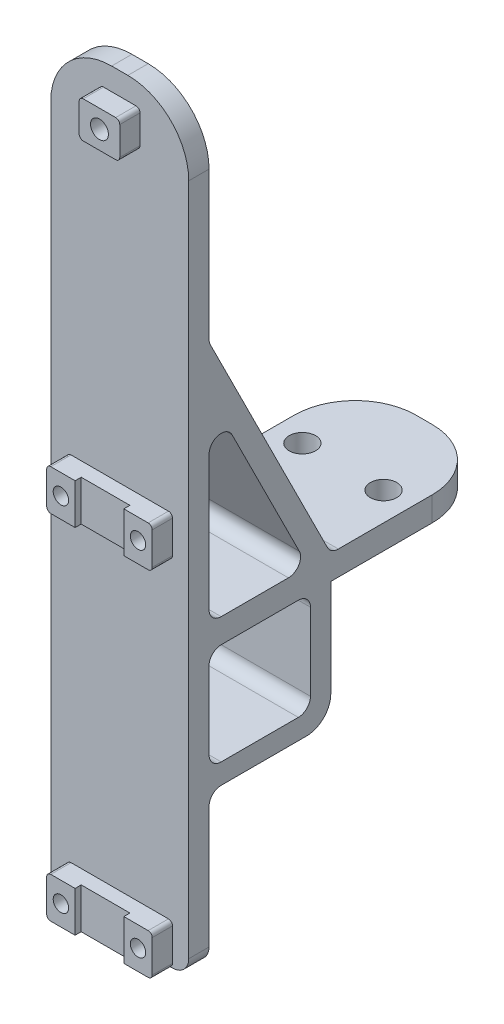
from build123d import *

# Parameters (mm, degrees)
EXTRUDE_1_DEPTH      = 3
EXTRUDE_1_DEPTH_BACK = 3
SKETCH_1_W           = 34
SKETCH_1_H           = 70
SKETCH_3_W           = 34
SKETCH_3_H           = 230
EXTRUDE_2_DEPTH      = 5
SKETCH_4_W           = 34
SKETCH_4_H           = 5
EXTRUDE_3_DEPTH      = 30
EXTRUDE_START        = -5
EXTRUDE_4_OUTLINE_W  = 34
EXTRUDE_4_OUTLINE_H  = 25
EXTRUDE_4_DEPTH      = 5
SKETCH_7_R           = 2.2
CUT_EXTRUDE_1_DEPTH  = 139.343774706
SKETCH_9_R           = 3.25
CUT_EXTRUDE_3_DEPTH  = 126.749751491
EXTRUDE_5_DEPTH      = 34
SKETCH_12_W          = 37
SKETCH_12_H          = 52.36766615
CUT_EXTRUDE_5_DEPTH  = 139.343774706
EXTRUDE_START_2      = 3.5
SKETCH_13_W          = 12
SKETCH_13_H          = 10
SKETCH_13_W_2        = 10
SKETCH_13_H_2        = 9
SKETCH_13_R          = 2.2
EXTRUDE_6_DEPTH      = 3.5
EXTRUDE_START_3      = 1.5
SKETCH_14_W          = 10
SKETCH_14_H          = 9
SKETCH_14_R          = 2.2
EXTRUDE_7_DEPTH      = 1.5
SKETCH_15_W          = 7
SKETCH_15_H          = 10
SKETCH_15_R          = 1.9
EXTRUDE_8_DEPTH      = 5
FILLET_2_R           = 15
FILLET_3_R           = 4
FILLET_4_R           = 3
FILLET_5_R           = 6
FILLET_6_R           = 1


# Read off the part's stored shape, not the designer's step: 凸台-拉伸4
with BuildPart() as part:
    # 草图1 → 凸台-拉伸1 (new, two sides: drawn at the far end of the back side and taken through both)
    with BuildSketch(Plane(origin=(0, 0, 0), x_dir=(1, 0, 0), z_dir=(0, 1, 0)).offset(-EXTRUDE_1_DEPTH_BACK)):
        Rectangle(SKETCH_1_W, SKETCH_1_H)
    extrude(amount=EXTRUDE_1_DEPTH + EXTRUDE_1_DEPTH_BACK)

    # 草图3 → 凸台-拉伸2 (add)
    with BuildSketch(Plane.XY.offset(35)):
        Rectangle(SKETCH_3_W, SKETCH_3_H)
    extrude(amount=EXTRUDE_2_DEPTH)

    # 草图4 → 凸台-拉伸3 (add)
    with BuildSketch(Plane.XZ.offset(3)):
        with Locations((0, 7.5)):
            Rectangle(SKETCH_4_W, SKETCH_4_H)
    extrude(amount=EXTRUDE_3_DEPTH)

    # 凸台-拉伸4 outline → 凸台-拉伸4 (add)
    with BuildSketch(Plane.XZ.offset(33).offset(EXTRUDE_START)):
        with Locations((0, 22.5)):
            Rectangle(EXTRUDE_4_OUTLINE_W, EXTRUDE_4_OUTLINE_H)
    extrude(amount=EXTRUDE_4_DEPTH)

    # 草图7 → 切除-拉伸1 (cut, through all)
    with BuildSketch(Plane.XY.offset(40)):
        with Locations((0, -105)):
            Circle(SKETCH_7_R)
        with Locations((0, 105)):
            Circle(SKETCH_7_R)
    extrude(amount=-CUT_EXTRUDE_1_DEPTH, mode=Mode.SUBTRACT)

    # 草图9 → 切除-拉伸3 (cut, through all)
    with BuildSketch(Plane.XZ.offset(3)):
        with Locations(Location((10, -15, 0), (0, 0, 270))):
            Circle(SKETCH_9_R)
        with Locations(Location((-10, -15, 0), (0, 0, 270))):
            Circle(SKETCH_9_R)
    extrude(amount=-CUT_EXTRUDE_3_DEPTH, mode=Mode.SUBTRACT)

    # 草图10 → 凸台-拉伸5 (add)
    with BuildSketch(Plane(origin=(17, 0, 0), x_dir=(0, 0, -1), z_dir=(1, 0, 0))):
        Polygon((-35, 51.819660113), (-35, 63), (-5, 3), (-10.590169944, 3), align=None)
    extrude(amount=-EXTRUDE_5_DEPTH)

    # 草图12 → 切除-拉伸5 (cut, through all)
    with BuildSketch(Plane.XY.offset(40)):
        with Locations((-1.5, -96.183833075)):
            Rectangle(SKETCH_12_W, SKETCH_12_H)
    extrude(amount=-CUT_EXTRUDE_5_DEPTH, mode=Mode.SUBTRACT)

    # 草图13 → 凸台-拉伸6 (add)
    # profile 1 of 3: a face of its own
    with BuildSketch(Plane.XY.offset(40).offset(EXTRUDE_START_2)):
        with Locations((0, -65)):
            Rectangle(SKETCH_13_W, SKETCH_13_H)
    # profile 2 of 3: a face of its own
    with BuildSketch(Plane.XY.offset(40).offset(EXTRUDE_START_2)):
        with Locations((0, 22)):
            Rectangle(SKETCH_13_W, SKETCH_13_H)
    # profile 3 of 3: a face of its own
    with BuildSketch(Plane.XY.offset(40).offset(EXTRUDE_START_2)):
        with Locations((0, 105)):
            Rectangle(SKETCH_13_W_2, SKETCH_13_H_2)
        with Locations((0, 105)):
            Circle(SKETCH_13_R, mode=Mode.SUBTRACT)
    extrude(amount=-EXTRUDE_6_DEPTH)

    # 草图14 → 凸台-拉伸7 (add)
    with BuildSketch(Plane.XY.offset(43.5).offset(EXTRUDE_START_3)):
        with Locations((0, 105)):
            Rectangle(SKETCH_14_W, SKETCH_14_H)
        with Locations((0, 105)):
            Circle(SKETCH_14_R, mode=Mode.SUBTRACT)
    extrude(amount=-EXTRUDE_7_DEPTH)

    # 草图15 → 凸台-拉伸8 (add)
    # profile 1 of 4: a face of its own
    with BuildSketch(Plane.XY.offset(40)):
        with Locations((-9.5, 22)):
            Rectangle(SKETCH_15_W, SKETCH_15_H)
        with Locations((-9.5, 22)):
            Circle(SKETCH_15_R, mode=Mode.SUBTRACT)
    # profile 2 of 4: a face of its own
    with BuildSketch(Plane.XY.offset(40)):
        with Locations((-9.5, -65)):
            Rectangle(SKETCH_15_W, SKETCH_15_H)
        with Locations((-9.5, -65)):
            Circle(SKETCH_15_R, mode=Mode.SUBTRACT)
    # profile 3 of 4: a face of its own
    with BuildSketch(Plane.XY.offset(40)):
        with Locations((9.5, 22)):
            Rectangle(SKETCH_15_W, SKETCH_15_H)
        with Locations(Location((9.5, 22, 0), (0, 0, 180))):
            Circle(SKETCH_15_R, mode=Mode.SUBTRACT)
    # profile 4 of 4: a face of its own
    with BuildSketch(Plane.XY.offset(40)):
        with Locations((9.5, -65)):
            Rectangle(SKETCH_15_W, SKETCH_15_H)
        with Locations(Location((9.5, -65, 0), (0, 0, 180))):
            Circle(SKETCH_15_R, mode=Mode.SUBTRACT)
    extrude(amount=EXTRUDE_8_DEPTH)

    # 圆角2
    fillet_2_edges = [part.edges().sort_by_distance(p)[0] for p in [
        (17, 115, 37.5),
        (-17, 115, 37.5),
        (-17, 0, -35),
        (17, 0, -35),
    ]]
    fillet(fillet_2_edges, radius=FILLET_2_R)

    # 圆角3
    fillet_3_edges = [part.edges().sort_by_distance(p)[0] for p in [
        (-17, -70, 37.5),
        (17, -70, 37.5),
    ]]
    fillet(fillet_3_edges, radius=FILLET_3_R)

    # 圆角4
    fillet_4_edges = [part.edges().sort_by_distance(p)[0] for p in [
        (0, 3, 5),
        (0, 3, 10.590169944),
        (0, 51.819660113, 35),
        (0, 63, 35),
        (0, -3, 35),
        (0, 3, 35),
        (0, -3, 10),
        (0, -28, 10),
        (0, -33, 35),
        (0, -28, 35),
    ]]
    fillet(fillet_4_edges, radius=FILLET_4_R)

    # 圆角5
    fillet_5_edges = [part.edges().sort_by_distance(p)[0] for p in [
        (0, -33, 5),
    ]]
    fillet(fillet_5_edges, radius=FILLET_5_R)

    # 圆角6
    fillet_6_edges = [part.edges().sort_by_distance(p)[0] for p in [
        (5, 100.5, 42.5),
        (5, 109.5, 42.5),
        (-5, 109.5, 42.5),
        (-5, 100.5, 42.5),
        (-13, 27, 42.5),
        (-13, 17, 42.5),
        (-13, -60, 42.5),
        (-13, -70, 42.5),
        (13, 27, 42.5),
        (13, 17, 42.5),
        (13, -70, 42.5),
        (13, -60, 42.5),
    ]]
    fillet(fillet_6_edges, radius=FILLET_6_R)


solid = part.part
